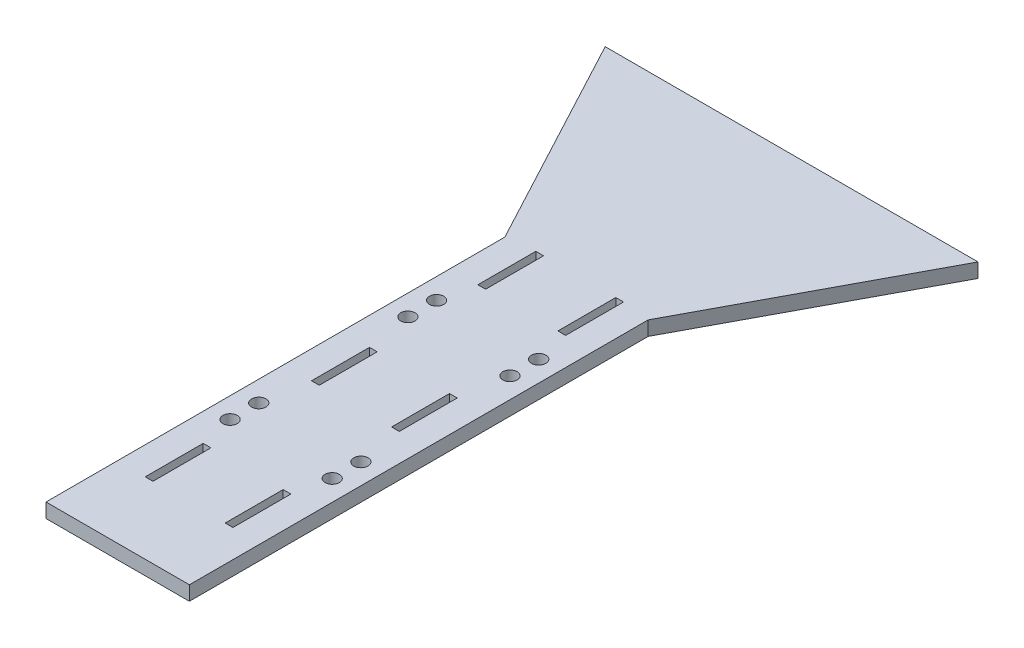
from build123d import *

# Parameters (mm, degrees)
BOSS_EXTRUDE1_DEPTH = 6.35
SKETCH2_W           = 3.429
SKETCH2_H           = 25.654
CUT_EXTRUDE1_DEPTH  = 310.721209316
SKETCH3_R           = 3.175
CUT_EXTRUDE2_DEPTH  = 310.721209316


with BuildPart() as part:
    # Sketch1 → Boss-Extrude1 (new body)
    with BuildSketch(Plane(origin=(0, 0, 0), x_dir=(1, 0, 0), z_dir=(0, 1, 0))):
        Polygon((-31.75, 0), (31.75, 0), (31.75, 203.2), (82.55, 298.45), (-82.55, 298.45), (-31.75, 203.2), align=None)
    extrude(amount=BOSS_EXTRUDE1_DEPTH)

    # Sketch2 → Cut-Extrude1 (cut, through all)
    with BuildSketch(Plane(origin=(0, 6.35, 0), x_dir=(1, 0, 0), z_dir=(0, 1, 0))):
        with Locations((-17.7165, 44.45)):
            Rectangle(SKETCH2_W, SKETCH2_H)
        with Locations((-17.7165, 118.11)):
            Rectangle(SKETCH2_W, SKETCH2_H)
        with Locations((-17.7165, 191.77)):
            Rectangle(SKETCH2_W, SKETCH2_H)
        with Locations((17.7165, 191.77)):
            Rectangle(SKETCH2_W, SKETCH2_H)
        with Locations((17.7165, 118.11)):
            Rectangle(SKETCH2_W, SKETCH2_H)
        with Locations((17.7165, 44.45)):
            Rectangle(SKETCH2_W, SKETCH2_H)
    extrude(amount=-CUT_EXTRUDE1_DEPTH, mode=Mode.SUBTRACT)

    # Sketch3 → Cut-Extrude2 (cut, through all)
    with BuildSketch(Plane(origin=(0, 6.35, 0), x_dir=(1, 0, 0), z_dir=(0, 1, 0))):
        with Locations((-22.606, 163.83)):
            Circle(SKETCH3_R)
        with Locations((-22.606, 151.13)):
            Circle(SKETCH3_R)
        with Locations((22.606, 151.13)):
            Circle(SKETCH3_R)
        with Locations((22.606, 163.83)):
            Circle(SKETCH3_R)
        with Locations((22.606, 85.09)):
            Circle(SKETCH3_R)
        with Locations((22.606, 72.39)):
            Circle(SKETCH3_R)
        with Locations((-22.606, 72.39)):
            Circle(SKETCH3_R)
        with Locations((-22.606, 85.09)):
            Circle(SKETCH3_R)
    extrude(amount=-CUT_EXTRUDE2_DEPTH, mode=Mode.SUBTRACT)


solid = part.part
